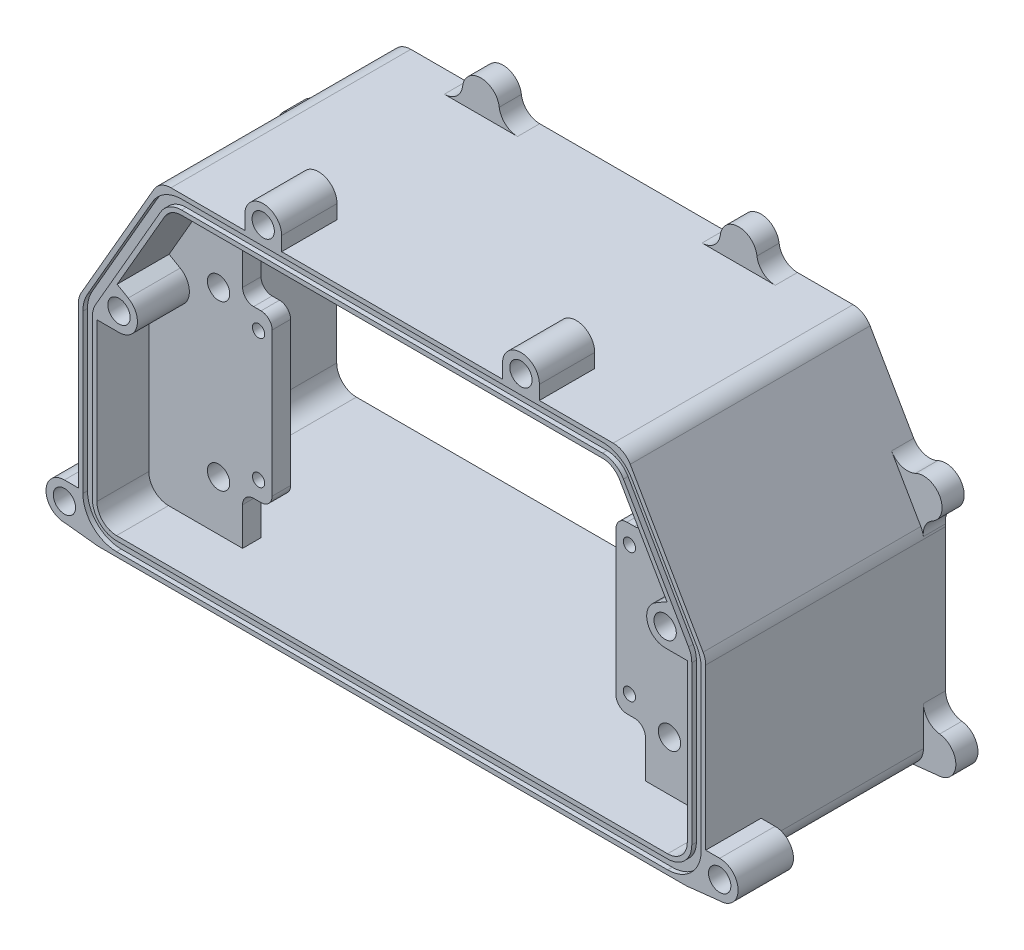
from build123d import *

# Parameters (mm, degrees)
BOSS_EXTRUDE1_DEPTH = 32.5
CUT_EXTRUDE1_DEPTH  = 117.871724553
SHELL1_T            = -5
CUT_EXTRUDE2_DEPTH  = 115.166545012
FILLET1_R           = 5.334
CUT_EXTRUDE3_DEPTH  = 1.2446
BOSS_EXTRUDE2_DEPTH = 15
SKETCH8_R           = 3.025
CUT_EXTRUDE4_DEPTH  = 8
SKETCH9_W           = 13
SKETCH9_H           = 71.043852495
SKETCH9_R           = 3.025
BOSS_EXTRUDE3_DEPTH = 5
SKETCH10_W          = 8
SKETCH10_H          = 45
SKETCH10_R          = 1.665
BOSS_EXTRUDE4_DEPTH = 5
FILLET2_R           = 3
BOSS_EXTRUDE5_START = -6
BOSS_EXTRUDE5_DEPTH = 6
CUT_EXTRUDE5_START  = -5
SKETCH12_R          = 3.025
CUT_EXTRUDE5_DEPTH  = 133.011434283
FILLET3_R           = 5
FILLET4_R           = 5


with BuildPart() as part:
    # Sketch1 → Boss-Extrude1 (new, symmetric)
    with BuildSketch(Plane.XY):
        Polygon((-77.629057899, 47), (-85, -47), (85, -47), (77.629057899, 47), align=None)
        Polygon((-85, 47), (-85, -47), (-77.629057899, 47), align=None)
        Polygon((77.629057899, 47), (85, -47), (85, 47), align=None)
    extrude(amount=BOSS_EXTRUDE1_DEPTH, both=True)

    # Sketch2 → Cut-Extrude1 (cut, through all)
    with BuildSketch(Plane(origin=(0, 0, -32.5), x_dir=(-1, 0, 0), z_dir=(0, 0, -1))):
        Polygon((-85, 47), (-85, 8.88), (-63, 47), align=None)
        Polygon((85, 47), (63, 47), (85, 8.88), align=None)
    extrude(amount=-CUT_EXTRUDE1_DEPTH, mode=Mode.SUBTRACT)

    # Shell1
    shell1_openings = [part.faces().sort_by_distance(p)[0] for p in [
        (0, -1.899417296, -32.5),
    ]]
    offset(amount=SHELL1_T, openings=shell1_openings, kind=Kind.INTERSECTION)

    # Sketch4 → Cut-Extrude2 (cut, through all)
    with BuildSketch(Plane(origin=(0, 0, 27.5), x_dir=(-1, 0, 0), z_dir=(0, 0, -1))):
        Polygon((-60.112685071, 42), (-80, 7.540707041), (-80, -42), (80, -42), (80, 7.540707041), (60.112685071, 42), align=None)
    extrude(amount=-CUT_EXTRUDE2_DEPTH, mode=Mode.SUBTRACT)

    # Fillet1
    fillet1_edges = [part.edges().sort_by_distance(p)[0] for p in [
        (85, 8.88, 0),
        (63, 47, 0),
        (-85, 8.88, 0),
        (-63, 47, 0),
        (60.112685071, 42, 0),
        (-80, 7.540707041, 0),
        (-80, -42, 0),
        (80, -42, 0),
        (-60.112685071, 42, 0),
        (80, 7.540707041, 0),
        (-85, -47, 0),
        (85, -47, 0),
    ]]
    fillet(fillet1_edges, radius=FILLET1_R)

    # Sketch5 → Cut-Extrude3 (cut)
    with BuildSketch(Plane.XY.offset(32.5)):
        with BuildLine():
            Line((-83.7827, 6.111949312), (-83.7827, -36.666))
            ThreePointArc((-83.7827, -36.666), (-81.112480392, -43.112480392), (-74.666, -45.7827))
            Line((-74.666, -45.7827), (74.666, -45.7827))
            ThreePointArc((74.666, -45.7827), (81.112480392, -43.112480392), (83.7827, -36.666))
            Line((83.7827, -36.666), (83.7827, 6.111949312))
            ThreePointArc((83.7827, 6.111949312), (83.472255412, 8.470780486), (82.562064351, 10.668964415))
            Line((82.562064351, 10.668964415), (64.928561855, 41.223015103))
            ThreePointArc((64.928561855, 41.223015103), (61.591514904, 44.560908438), (57.032497504, 45.7827))
            Line((57.032497504, 45.7827), (-57.032497504, 45.7827))
            ThreePointArc((-57.032497504, 45.7827), (-61.591514904, 44.560908438), (-64.928561855, 41.223015103))
            Line((-64.928561855, 41.223015103), (-82.562064351, 10.668964415))
            ThreePointArc((-82.562064351, 10.668964415), (-83.472255412, 8.470780486), (-83.7827, 6.111949312))
        make_face()
        with BuildLine():
            Line((-62.706643454, 39.940690737), (-80.34014595, 9.386640049))
            ThreePointArc((-80.34014595, 9.386640049), (-80.994213178, 7.807015583), (-81.2173, 6.111949312))
            Line((-81.2173, 6.111949312), (-81.2173, -36.666))
            ThreePointArc((-81.2173, -36.666), (-79.298468656, -41.298468656), (-74.666, -43.2173))
            Line((-74.666, -43.2173), (74.666, -43.2173))
            ThreePointArc((74.666, -43.2173), (79.298468656, -41.298468656), (81.2173, -36.666))
            Line((81.2173, -36.666), (81.2173, 6.111949312))
            ThreePointArc((81.2173, 6.111949312), (80.994213178, 7.807015583), (80.34014595, 9.386640049))
            Line((80.34014595, 9.386640049), (62.706643454, 39.940690737))
            ThreePointArc((62.706643454, 39.940690737), (60.3086271, 42.339315306), (57.032497504, 43.2173))
            Line((57.032497504, 43.2173), (-57.032497504, 43.2173))
            ThreePointArc((-57.032497504, 43.2173), (-60.3086271, 42.339315306), (-62.706643454, 39.940690737))
        make_face(mode=Mode.SUBTRACT)
    cut_extrude3 = extrude(amount=-CUT_EXTRUDE3_DEPTH, mode=Mode.SUBTRACT)

    # Mirror1: Cut-Extrude3 across plane
    add(cut_extrude3.mirror(Plane.XY), mode=Mode.SUBTRACT)

    # Sketch7 → Boss-Extrude2 (add)
    with BuildSketch(Plane.XY.offset(32.5)):
        with BuildLine():
            Line((85, -36), (85, -41.666))
            ThreePointArc((85, -41.666), (83.826467914, -45.003972849), (80.822248692, -46.873172454))
            Line((80.822248692, -46.873172454), (88.7827, -46))
            ThreePointArc((88.7827, -46), (93.7827, -41), (88.7827, -36))
            Line((88.7827, -36), (85, -36))
        make_face()
        with BuildLine():
            Line((74.503985248, 17.063801693), (71.500732116, 15.330549624))
            ThreePointArc((71.500732116, 15.330549624), (69.170261492, 9.706313044), (74, 6))
            Line((74, 6), (80, 6))
            Line((80, 6), (80, 6.111949312))
            ThreePointArc((80, 6.111949312), (79.818365041, 7.492054556), (79.285830339, 8.77816829))
            Line((79.285830339, 8.77816829), (74.503985248, 17.063801693))
        make_face()
        with BuildLine():
            ThreePointArc((39.919812433, 50.7827), (34.919812433, 55.7827), (29.919812433, 50.7827))
            Line((29.919812433, 50.7827), (29.919812433, 47))
            Line((29.919812433, 47), (39.919812433, 47))
            Line((39.919812433, 47), (39.919812433, 50.7827))
        make_face()
    boss_extrude2 = extrude(amount=-BOSS_EXTRUDE2_DEPTH)

    # Sketch8 → Cut-Extrude4 (cut)
    with BuildSketch(Plane.XY.offset(32.5)):
        with Locations((34.919812433, 50.7827)):
            Circle(SKETCH8_R)
        with Locations((74, 11)):
            Circle(SKETCH8_R)
        with Locations((88.7827, -41)):
            Circle(SKETCH8_R)
    cut_extrude4 = extrude(amount=-CUT_EXTRUDE4_DEPTH, mode=Mode.SUBTRACT)

    # Mirror2: Boss-Extrude2, Cut-Extrude4 across plane
    add(boss_extrude2.mirror(Plane(origin=(0, 0, 0), x_dir=(0, 0, 1), z_dir=(1, 0, 0))))
    add(cut_extrude4.mirror(Plane(origin=(0, 0, 0), x_dir=(0, 0, 1), z_dir=(1, 0, 0))), mode=Mode.SUBTRACT)

    # Sketch9 → Boss-Extrude3 (add)
    # profile 1 of 3: a face of its own
    with BuildSketch(Plane(origin=(0, 0, 18.42), x_dir=(-1, 0, 0), z_dir=(0, 0, -1))):
        with BuildLine():
            Line((54.59, 42), (54.59, 29.043852495))
            Line((54.59, 29.043852495), (67.59, 29.043852495))
            Line((67.59, 29.043852495), (61.652327843, 39.332218978))
            ThreePointArc((61.652327843, 39.332218978), (59.699887986, 41.285154037), (57.032497504, 42))
            Line((57.032497504, 42), (54.59, 42))
        make_face()
    # profile 2 of 3: a face of its own
    with BuildSketch(Plane(origin=(0, 0, 18.42), x_dir=(-1, 0, 0), z_dir=(0, 0, -1))):
        with Locations((61.09, -6.478073752)):
            Rectangle(SKETCH9_W, SKETCH9_H)
        with Locations((61.09, -28.48125)):
            Circle(SKETCH9_R, mode=Mode.SUBTRACT)
        with Locations((61.09, 15.96875)):
            Circle(SKETCH9_R, mode=Mode.SUBTRACT)
    # profile 3 of 3: a face of its own
    with BuildSketch(Plane(origin=(0, 0, 18.42), x_dir=(-1, 0, 0), z_dir=(0, 0, -1))):
        with BuildLine():
            Line((67.59, 29.043852495), (67.59, -42))
            Line((67.59, -42), (74.666, -42))
            ThreePointArc((74.666, -42), (78.437707571, -40.437707571), (80, -36.666))
            Line((80, -36.666), (80, 6.111949312))
            ThreePointArc((80, 6.111949312), (79.818365041, 7.492054556), (79.285830339, 8.77816829))
            Line((79.285830339, 8.77816829), (67.59, 29.043852495))
        make_face()
    boss_extrude3 = extrude(amount=BOSS_EXTRUDE3_DEPTH)

    # Mirror3: Boss-Extrude3 across plane
    add(boss_extrude3.mirror(Plane(origin=(0, 0, 0), x_dir=(0, 0, 1), z_dir=(1, 0, 0))))


with BuildPart() as body_2:
    # Sketch10 → Boss-Extrude4 (new body)
    with BuildSketch(Plane(origin=(0, 0, 13.42), x_dir=(-1, 0, 0), z_dir=(0, 0, -1))):
        with Locations((50.59, -6.25625)):
            Rectangle(SKETCH10_W, SKETCH10_H)
        with Locations((50.25, -23.75625)):
            Circle(SKETCH10_R, mode=Mode.SUBTRACT)
        with Locations((50.25, 11.24375)):
            Circle(SKETCH10_R, mode=Mode.SUBTRACT)
    extrude(amount=-BOSS_EXTRUDE4_DEPTH)


with BuildPart() as body_3:
    # Mirror9: mirrored copy
    add(body_2.part.mirror(Plane(origin=(0, 0, 0), x_dir=(0, 0, 1), z_dir=(1, 0, 0))))


with BuildPart() as part_1:
    add(part.part)

    # Combine2: union body 2, body 3
    add(body_2.part)
    add(body_3.part)

    # Fillet2
    fillet2_edges = [part_1.edges().sort_by_distance(p)[0] for p in [
        (-54.59, 16.24375, 15.92),
        (-54.59, -28.75625, 15.92),
        (-46.59, -28.75625, 15.92),
        (-46.59, 16.24375, 15.92),
        (54.59, -28.75625, 15.92),
        (46.59, -28.75625, 15.92),
        (46.59, 16.24375, 15.92),
        (54.59, 16.24375, 15.92),
    ]]
    fillet(fillet2_edges, radius=FILLET2_R)

    # Sketch11 → Boss-Extrude5 (add)
    with BuildSketch(Plane(origin=(0, 0, -32.5), x_dir=(-1, 0, 0), z_dir=(0, 0, -1)).offset(BOSS_EXTRUDE5_START)):
        with BuildLine():
            Line((-81.333802755, 15.232519953), (-78.834534872, 19.563069577))
            Line((-78.834534872, 19.563069577), (-82.543823846, 21.70379249))
            ThreePointArc((-82.543823846, 21.70379249), (-89.373641354, 19.87251075), (-87.542359614, 13.042693242))
            Line((-87.542359614, 13.042693242), (-83.833070639, 10.901970329))
            Line((-83.833070639, 10.901970329), (-81.333802755, 15.232519953))
        make_face()
        with BuildLine():
            ThreePointArc((-80.822248692, -46.873172454), (-83.826467914, -45.003972849), (-85, -41.666))
            Line((-85, -41.666), (-85, -36))
            Line((-85, -36), (-88.7827, -36))
            ThreePointArc((-88.7827, -36), (-93.7827, -41), (-88.7827, -46))
            Line((-88.7827, -46), (-80.822248692, -46.873172454))
        make_face()
        with BuildLine():
            Line((-29.919812433, 47), (-29.919812433, 50.7827))
            ThreePointArc((-29.919812433, 50.7827), (-34.919812433, 55.7827), (-39.919812433, 50.7827))
            Line((-39.919812433, 50.7827), (-39.919812433, 47))
            Line((-39.919812433, 47), (-29.919812433, 47))
        make_face()
        with BuildLine():
            Line((-29.919812433, -50.7827), (-29.919812433, -47))
            Line((-29.919812433, -47), (-39.919812433, -47))
            Line((-39.919812433, -47), (-39.919812433, -50.7827))
            ThreePointArc((-39.919812433, -50.7827), (-34.919812433, -55.7827), (-29.919812433, -50.7827))
        make_face()
    boss_extrude5 = extrude(amount=BOSS_EXTRUDE5_DEPTH)

    # Sketch12 → Cut-Extrude5 (cut)
    with BuildSketch(Plane(origin=(0, 0, -32.5), x_dir=(-1, 0, 0), z_dir=(0, 0, -1)).offset(CUT_EXTRUDE5_START)):
        with Locations(Location((-88.7827, -41, 0), (0, 0, 180))):
            Circle(SKETCH12_R)
        with Locations(Location((-34.919812433, 50.7827, 0), (0, 0, 180))):
            Circle(SKETCH12_R)
        with Locations(Location((-85.04309173, 17.373242866, 0), (0, 0, 180))):
            Circle(SKETCH12_R)
        with Locations(Location((-34.919812433, -50.7827, 0), (0, 0, 180))):
            Circle(SKETCH12_R)
    cut_extrude5 = extrude(amount=CUT_EXTRUDE5_DEPTH, mode=Mode.SUBTRACT)

    # Fillet3
    # the kernel refuses this fillet: 5 mm, written as the material it adds along each edge
    with BuildSketch(Plane(origin=(29.919812433, -47, -26.5), x_dir=(-1, 0, 0), z_dir=(0, 0, -1)), Plane(origin=(39.919812433, 47, -26.5), x_dir=(1, 0, 0), z_dir=(0, 0, -1))) as fillet3_piece_1:
        with BuildLine():
            CenterArc((4.925632509, -5), FILLET3_R, 90, 83.008043677)
            Line((-0.037183745, -4.39135), (-0.533465371, -4.330485))
            ThreePointArc((-0.533465371, -4.330485), (-0.5, -3.7827), (-0.5, 0))
            Line((-0.5, 0), (0, 0.5))
            Line((0, 0.5), (4.925632509, 0.5))
            Line((4.925632509, 0.5), (4.925632509, 0))
        make_face()
    extrude(amount=6)
    with BuildSketch(Plane(origin=(39.919812433, -47, -26.5), x_dir=(1, 0, 0), z_dir=(0, 0, -1)), Plane(origin=(85, -36, -26.5), x_dir=(0, 1, 0), z_dir=(0, 0, -1)), Plane(origin=(29.919812433, 47, -26.5), x_dir=(-1, 0, 0), z_dir=(0, 0, -1))) as fillet3_piece_2:
        with BuildLine():
            CenterArc((4.925632509, 5), FILLET3_R, 186.991956323, 83.008043677)
            Line((-0.037183745, 4.39135), (-0.533465371, 4.330485))
            ThreePointArc((-0.533465371, 4.330485), (-0.5, 3.7827), (-0.5, 0))
            Line((-0.5, 0), (0, -0.5))
            Line((0, -0.5), (4.925632509, -0.5))
            Line((4.925632509, -0.5), (4.925632509, 0))
        make_face()
    extrude(amount=6)
    with BuildSketch(Plane(origin=(78.834534872, 19.563069577, -26.5), x_dir=(-0.4998535767411268, 0.8661099247896323, 0), z_dir=(0, 0, -1))) as fillet3_piece_3:
        with BuildLine():
            CenterArc((4.974240859, 5), FILLET3_R, 184.113358758, 85.886641242)
            Line((-0.012879571, 4.64135), (-0.511591614, 4.605485))
            ThreePointArc((-0.511591614, 4.605485), (-0.5, 4.2827), (-0.5, 0))
            Line((-0.5, 0), (0, -0.5))
            Line((0, -0.5), (4.974240859, -0.5))
            Line((4.974240859, -0.5), (4.974240859, 0))
        make_face()
    extrude(amount=6)
    with BuildSketch(Plane(origin=(83.833070639, 10.901970329, -26.5), x_dir=(0.3707788707972148, -0.928721179348432, 0), z_dir=(0, 0, -1))) as fillet3_piece_4:
        with BuildLine():
            CenterArc((4.354104375, -4.827056441), FILLET3_R, 105.113485931, 66.659861159)
            Line((-0.594444503, -4.111609724), (-1.089299391, -4.040065052))
            Line((-1.089299391, -4.040065052), (-0.494854888, 0.071544672))
            Line((-0.494854888, 0.071544672), (0.071544672, 0.494854888))
            ThreePointArc((0.071544672, 0.494854888), (0.9680086, 0.365246756), (2.920079758, 0.482705644))
            Line((2.920079758, 0.482705644), (3.050445632, 0))
        make_face()
    extrude(amount=6)

    # Mirror14: Boss-Extrude5, Cut-Extrude5 across plane
    add(boss_extrude5.mirror(Plane(origin=(0, 0, 0), x_dir=(0, 0, 1), z_dir=(1, 0, 0))))
    add(cut_extrude5.mirror(Plane(origin=(0, 0, 0), x_dir=(0, 0, 1), z_dir=(1, 0, 0))), mode=Mode.SUBTRACT)

    # Fillet4
    # the kernel refuses this fillet: 5 mm, written as the material it adds along each edge
    with BuildSketch(Plane(origin=(-29.919812433, 47, -26.5), x_dir=(1, 0, 0), z_dir=(0, 0, -1)), Plane(origin=(-39.919812433, -47, -26.5), x_dir=(-1, 0, 0), z_dir=(0, 0, -1))) as fillet4_piece_1:
        with BuildLine():
            CenterArc((4.925632509, -5), FILLET4_R, 90, 83.008043677)
            Line((-0.037183745, -4.39135), (-0.533465371, -4.330485))
            ThreePointArc((-0.533465371, -4.330485), (-0.5, -3.7827), (-0.5, 0))
            Line((-0.5, 0), (0, 0.5))
            Line((0, 0.5), (4.925632509, 0.5))
            Line((4.925632509, 0.5), (4.925632509, 0))
        make_face()
    extrude(amount=6)
    with BuildSketch(Plane(origin=(-39.919812433, 47, -26.5), x_dir=(-1, 0, 0), z_dir=(0, 0, -1)), Plane(origin=(-29.919812433, -47, -26.5), x_dir=(1, 0, 0), z_dir=(0, 0, -1))) as fillet4_piece_2:
        with BuildLine():
            CenterArc((4.925632509, 5), FILLET4_R, 186.991956323, 83.008043677)
            Line((-0.037183745, 4.39135), (-0.533465371, 4.330485))
            ThreePointArc((-0.533465371, 4.330485), (-0.5, 3.7827), (-0.5, 0))
            Line((-0.5, 0), (0, -0.5))
            Line((0, -0.5), (4.925632509, -0.5))
            Line((4.925632509, -0.5), (4.925632509, 0))
        make_face()
    extrude(amount=6)
    with BuildSketch(Plane(origin=(-78.834534872, 19.563069577, -26.5), x_dir=(0.4998535767411274, 0.866109924789632, 0), z_dir=(0, 0, -1))) as fillet4_piece_3:
        with BuildLine():
            CenterArc((4.974240859, -5), FILLET4_R, 90, 85.886641242)
            Line((-0.012879571, -4.64135), (-0.511591614, -4.605485))
            ThreePointArc((-0.511591614, -4.605485), (-0.5, -4.2827), (-0.5, 0))
            Line((-0.5, 0), (0, 0.5))
            Line((0, 0.5), (4.974240859, 0.5))
            Line((4.974240859, 0.5), (4.974240859, 0))
        make_face()
    extrude(amount=6)
    with BuildSketch(Plane(origin=(-83.833070639, 10.901970329, -26.5), x_dir=(-0.3707788707972107, -0.9287211793484336, 0), z_dir=(0, 0, -1))) as fillet4_piece_4:
        with BuildLine():
            CenterArc((4.354104375, 4.827056441), FILLET4_R, 188.22665291, 66.659861159)
            Line((-0.594444503, 4.111609724), (-1.089299391, 4.040065052))
            Line((-1.089299391, 4.040065052), (-0.494854888, -0.071544672))
            Line((-0.494854888, -0.071544672), (0.071544672, -0.494854888))
            ThreePointArc((0.071544672, -0.494854888), (0.9680086, -0.365246756), (2.920079758, -0.482705644))
            Line((2.920079758, -0.482705644), (3.050445632, 0))
        make_face()
    extrude(amount=6)
    with BuildSketch(Plane(origin=(-85, -36, -26.5), x_dir=(-0.9999641526703062, -0.008467194007259473, 0), z_dir=(0, 0, -1))) as fillet4_piece_5:
        with BuildLine():
            CenterArc((4.958114477, 4.967791909), FILLET4_R, 180.485140278, 83.008043677)
            Line((-0.041706286, 4.925455939), (-0.541688362, 4.921222342))
            Line((-0.541688362, 4.921222342), (-0.499982076, -0.004233597))
            Line((-0.499982076, -0.004233597), (0.004233597, -0.499982076))
            ThreePointArc((0.004233597, -0.499982076), (3.786797997, -0.467953222), (4.334846718, -0.496779191))
            Line((4.334846718, -0.496779191), (4.391507424, 0))
        make_face()
    extrude(amount=6)


solid = part_1.part
